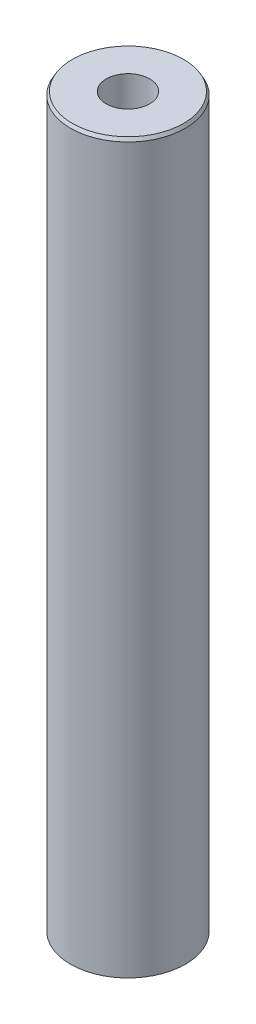
from build123d import *
from OCP.BRepFilletAPI import BRepFilletAPI_MakeChamfer

# Parameters (mm, degrees)
SKETCH1_R           = 45
BOSS_EXTRUDE1_DEPTH = 571.017711659
SKETCH2_R           = 17.011758707
CUT_EXTRUDE1_DEPTH  = 575.5530672
CHAMFER1_SIZE       = 2.539818985
CHAMFER1_SIZE2      = 1.466365175


with BuildPart() as part:
    # Sketch1 → Boss-Extrude1 (new body)
    with BuildSketch(Plane(origin=(0, 0, 0), x_dir=(1, 0, 0), z_dir=(0, 1, 0))):
        Circle(SKETCH1_R)
    extrude(amount=BOSS_EXTRUDE1_DEPTH)

    # Sketch2 → Cut-Extrude1 (cut, through all)
    with BuildSketch(Plane(origin=(0, 0, 0), x_dir=(1, 0, 0), z_dir=(0, 1, 0))):
        Circle(SKETCH2_R)
    extrude(amount=CUT_EXTRUDE1_DEPTH, mode=Mode.SUBTRACT)

    # Chamfer1: one chamfer whose edges measure the first distance from different faces: ONE call of the kernel's chamfer builder (chamfer() names one face for all edges)
    chamfer1_edges_1 = [part.edges().sort_by_distance(p)[0] for p in [
        (-45, 571.017711659, 0),
    ]]
    chamfer1_side_1 = [part.faces().sort_by_distance(p)[0] for p in [
        (-45, 285.50885583, 0),
    ]]
    chamfer1_edges_2 = [part.edges().sort_by_distance(p)[0] for p in [
        (-45, 0, 0),
    ]]
    chamfer1_side_2 = [part.faces().sort_by_distance(p)[0] for p in [
        (-43.727207794, 0, 0),
    ]]
    chamfer1 = BRepFilletAPI_MakeChamfer(part.part.solid().wrapped)
    for e in chamfer1_edges_1:
        chamfer1.Add(CHAMFER1_SIZE, CHAMFER1_SIZE2, e.wrapped, chamfer1_side_1[0].wrapped)  # the first distance lies on this face
    for e in chamfer1_edges_2:
        chamfer1.Add(CHAMFER1_SIZE, CHAMFER1_SIZE2, e.wrapped, chamfer1_side_2[0].wrapped)  # the first distance lies on this face
    add(Compound.cast(chamfer1.Shape()), mode=Mode.REPLACE)


solid = part.part
